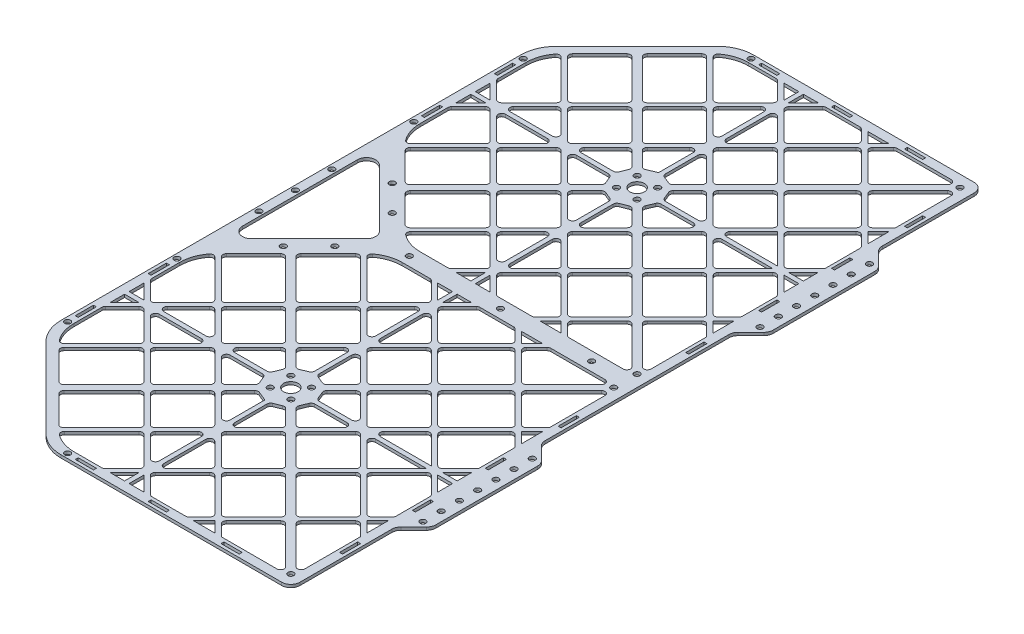
from build123d import *

# Parameters (mm, degrees)
SKETCH1_W               = 190
SKETCH1_H               = 190
BOSS_EXTRUDE1_DEPTH     = 1.6
CUT_EXTRUDE1_DEPTH      = 269.705340475
CUT_EXTRUDE2_DEPTH      = 269.705340475
FILLET1_R               = 20
FILLET5_R               = 5
BOSS_EXTRUDE2_DEPTH     = 1.6
BOSS_EXTRUDE3_DEPTH     = 1.6
BOSS_EXTRUDE5_DEPTH     = 1.6
BOSS_EXTRUDE7_DEPTH     = 1.6
BOSS_EXTRUDE8_DEPTH     = 1.6
BOSS_EXTRUDE9_DEPTH     = 1.6
FILLET3_R               = 2
SKETCH6_R               = 1.6
SKETCH6_R_2             = 4
CUT_EXTRUDE3_DEPTH      = 269.705340475
SKETCH11_W              = 10
SKETCH11_H              = 1.61
SKETCH11_W_2            = 1.61
SKETCH11_H_2            = 10
CUT_EXTRUDE5_DEPTH      = 269.705340475
BOSS_EXTRUDE11_DEPTH    = 1.6
SKETCH19_R              = 1.6
CUT_EXTRUDE8_DEPTH      = 276.86692444
FILLET4_R               = 5
CUT_EXTRUDE7_DEPTH      = 276.86692444
CUT_EXTRUDE7_DEPTH_BACK = 276.86692444
SKETCH17_R              = 1.6
SKETCH12_W              = 5
SKETCH12_H              = 97.157287526
BOSS_EXTRUDE6_DEPTH     = 1.6
FILLET2_R               = 5
SKETCH16_R              = 1.6
CUT_EXTRUDE6_DEPTH      = 430.421191839
SKETCH20_R              = 1.6
CUT_EXTRUDE9_DEPTH      = 430.421191839


with BuildPart() as part:
    # Sketch1 → Boss-Extrude1 (new body)
    with BuildSketch(Plane(origin=(0, 0, 0), x_dir=(1, 0, 0), z_dir=(0, 1, 0))):
        with Locations((95, 95)):
            Rectangle(SKETCH1_W, SKETCH1_H)
    extrude(amount=BOSS_EXTRUDE1_DEPTH)

    # Sketch2 → Cut-Extrude1 (cut, through all)
    with BuildSketch(Plane(origin=(0, 1.6, 0), x_dir=(1, 0, 0), z_dir=(0, 1, 0))):
        Polygon((0, 55.649711575), (55.649711575, 0), (0, 0), align=None)
        Polygon((0, 190), (48.578643763, 190), (0, 141.421356237), align=None)
    extrude(amount=-CUT_EXTRUDE1_DEPTH, mode=Mode.SUBTRACT)

    # Sketch4 → Cut-Extrude2 (cut, through all)
    with BuildSketch(Plane(origin=(0, 1.6, 0), x_dir=(1, 0, 0), z_dir=(0, 1, 0))):
        Polygon((57.720779386, 5), (185, 5), (185, 185), (57.720779386, 185), (5, 132.279220614), (5, 57.720779386), align=None)
    extrude(amount=-CUT_EXTRUDE2_DEPTH, mode=Mode.SUBTRACT)

    # Fillet1
    fillet1_edges = [part.edges().sort_by_distance(p)[0] for p in [
        (0, 0.8, -55.649711575),
        (55.649711575, 0.8, 0),
        (57.720779386, 0.8, -5),
        (5, 0.8, -57.720779386),
        (5, 0.8, -132.279220614),
        (57.720779386, 0.8, -185),
    ]]
    fillet(fillet1_edges, radius=FILLET1_R)

    # Fillet5
    fillet5_edges = [part.edges().sort_by_distance(p)[0] for p in [
        (190, 0.8, 0),
    ]]
    fillet(fillet5_edges, radius=FILLET5_R)



with BuildPart() as body_2:
    # Sketch5 → Boss-Extrude2 (new body)
    with BuildSketch(Plane(origin=(0, 1.6, 0), x_dir=(1, 0, 0), z_dir=(0, 1, 0))):
        Polygon((104.567085809, 85.432914191), (108.529902504, 95), (104.567085809, 104.567085809), (95, 108.529902504), (85.432914191, 104.567085809), (81.470097496, 95), (85.432914191, 85.432914191), (95, 81.470097496), align=None)
    extrude(amount=-BOSS_EXTRUDE2_DEPTH)


with BuildPart() as part_1:
    add(part.part)

    add(body_2.part)  # Boss-Extrude3 merges body 2
    # Sketch7 → Boss-Extrude3 (add)
    with BuildSketch(Plane(origin=(0, 1.6, 0), x_dir=(1, 0, 0), z_dir=(0, 1, 0))):
        Polygon((29.946176131, 157.225396744), (92.171572875, 95), (29.946176131, 32.774603256), (32.774603256, 29.946176131), (95, 92.171572875), (182.171572875, 5), (185, 5), (185, 7.828427125), (97.828427125, 95), (185, 182.171572875), (185, 185), (182.171572875, 185), (95, 97.828427125), (32.774603256, 160.053823869), align=None)
    extrude(amount=-BOSS_EXTRUDE3_DEPTH)

    # Sketch10 → Boss-Extrude5 (add)
    with BuildSketch(Plane(origin=(0, 1.6, 0), x_dir=(1, 0, 0), z_dir=(0, 1, 0))):
        Polygon((96.25, 185), (96.25, 96.25), (185, 96.25), (185, 93.75), (96.25, 93.75), (96.25, 5), (93.75, 5), (93.75, 93.75), (5, 93.75), (5, 96.25), (93.75, 96.25), (93.75, 185), align=None)
    extrude(amount=-BOSS_EXTRUDE5_DEPTH)

    # Sketch13 → Boss-Extrude7 (add)
    with BuildSketch(Plane(origin=(0, 1.6, 0), x_dir=(1, 0, 0), z_dir=(0, 1, 0))):
        Polygon((10.500739648, 52.220039738), (53.28069991, 95), (10.500739648, 137.779960262), (12.268506601, 139.547727215), (55.048466863, 96.767766953), (93.232233047, 134.951533137), (50.452272785, 177.731493399), (52.220039738, 179.499260352), (95, 136.71930009), (143.28069991, 185), (146.816233816, 185), (96.767766953, 134.951533137), (134.951533137, 96.767766953), (185, 146.816233816), (185, 143.28069991), (136.71930009, 95), (185, 46.71930009), (185, 43.183766184), (134.951533137, 93.232233047), (96.767766953, 55.048466863), (146.816233816, 5), (143.28069991, 5), (95, 53.28069991), (52.220039738, 10.500739648), (50.452272785, 12.268506601), (93.232233047, 55.048466863), (55.048466863, 93.232233047), (12.268506601, 50.452272785), align=None)
        Polygon((95, 56.816233816), (56.816233816, 95), (95, 133.183766184), (133.183766184, 95), align=None, mode=Mode.SUBTRACT)
    extrude(amount=-BOSS_EXTRUDE7_DEPTH)

    # Sketch14 → Boss-Extrude8 (add)
    with BuildSketch(Plane(origin=(0, 1.6, 0), x_dir=(1, 0, 0), z_dir=(0, 1, 0))):
        Polygon((5, 82.074639149), (16.157593898, 93.232233047), (93.232233047, 16.157593898), (82.074639149, 5), (85.610173055, 5), (95, 14.389826945), (104.389826945, 5), (107.925360851, 5), (96.767766953, 16.157593898), (173.842406102, 93.232233047), (185, 82.074639149), (185, 85.610173055), (175.610173055, 95), (185, 104.389826945), (185, 107.925360851), (173.842406102, 96.767766953), (96.767766953, 173.842406102), (107.925360851, 185), (104.389826945, 185), (95, 175.610173055), (85.610173055, 185), (82.074639149, 185), (93.232233047, 173.842406102), (16.157593898, 96.767766953), (5, 107.925360851), (5, 104.389826945), (14.389826945, 95), (5, 85.610173055), align=None)
        Polygon((95, 172.074639149), (172.074639149, 95), (95, 17.925360851), (17.925360851, 95), align=None, mode=Mode.SUBTRACT)
    extrude(amount=-BOSS_EXTRUDE8_DEPTH)

    # Sketch15 → Boss-Extrude9 (add)
    with BuildSketch(Plane(origin=(0, 1.6, 0), x_dir=(1, 0, 0), z_dir=(0, 1, 0))):
        Polygon((128.036579926, 185), (185, 128.036579926), (185, 131.572113832), (131.572113832, 185), align=None)
        Polygon((131.572113832, 5), (128.036579926, 5), (185, 61.963420074), (185, 58.427886168), align=None)
    extrude(amount=-BOSS_EXTRUDE9_DEPTH)

    # Fillet3
    fillet3_edges = [part_1.edges().sort_by_distance(p)[0] for p in [
        (29.946176131, 0.8, -32.774603256),
        (32.774603256, 0.8, -29.946176131),
        (182.171572875, 0.8, -5),
        (185, 0.8, -7.828427125),
        (185, 0.8, -182.171572875),
        (182.171572875, 0.8, -185),
        (32.774603256, 0.8, -160.053823869),
        (29.946176131, 0.8, -157.225396744),
        (87.432914191, 0.8, -105.395512934),
        (102.567085809, 0.8, -105.395512934),
        (105.395512934, 0.8, -102.567085809),
        (105.395512934, 0.8, -87.432914191),
        (102.567085809, 0.8, -84.604487066),
        (87.432914191, 0.8, -84.604487066),
        (84.604487066, 0.8, -87.432914191),
        (84.604487066, 0.8, -102.567085809),
        (81.987864449, 0.8, -93.75),
        (81.987864449, 0.8, -96.25),
        (96.25, 0.8, -81.987864449),
        (108.012135551, 0.8, -93.75),
        (108.012135551, 0.8, -96.25),
        (96.25, 0.8, -108.012135551),
        (93.75, 0.8, -108.012135551),
        (96.25, 0.8, -131.933766184),
        (96.25, 0.8, -137.96930009),
        (93.75, 0.8, -131.933766184),
        (93.75, 0.8, -137.96930009),
        (137.96930009, 0.8, -96.25),
        (131.933766184, 0.8, -93.75),
        (137.96930009, 0.8, -93.75),
        (96.25, 0.8, -52.03069991),
        (93.75, 0.8, -58.066233816),
        (93.75, 0.8, -52.03069991),
        (52.03069991, 0.8, -96.25),
        (52.03069991, 0.8, -93.75),
        (75.554563517, 0.8, -117.273863607),
        (114.445436483, 0.8, -117.273863607),
        (117.273863607, 0.8, -75.554563517),
        (75.554563517, 0.8, -72.726136393),
        (72.726136393, 0.8, -75.554563517),
        (114.445436483, 0.8, -72.726136393),
        (117.273863607, 0.8, -114.445436483),
        (72.726136393, 0.8, -114.445436483),
        (55.048466863, 0.8, -96.767766953),
        (74.493903346, 0.8, -77.32233047),
        (77.32233047, 0.8, -74.493903346),
        (58.066233816, 0.8, -93.75),
        (112.67766953, 0.8, -74.493903346),
        (115.506096654, 0.8, -77.32233047),
        (96.25, 0.8, -58.066233816),
        (74.493903346, 0.8, -112.67766953),
        (77.32233047, 0.8, -115.506096654),
        (58.066233816, 0.8, -96.25),
        (115.506096654, 0.8, -112.67766953),
        (112.67766953, 0.8, -115.506096654),
        (131.933766184, 0.8, -96.25),
        (12.268506601, 0.8, -50.452272785),
        (10.505249519, 0.8, -52.224549609),
        (10.505249519, 0.8, -137.775450391),
        (12.268506601, 0.8, -139.547727215),
        (93.232233047, 0.8, -134.951533137),
        (50.452272785, 0.8, -177.731493399),
        (52.224549609, 0.8, -179.494750481),
        (146.816233816, 0.8, -185),
        (96.767766953, 0.8, -134.951533137),
        (134.951533137, 0.8, -96.767766953),
        (185, 0.8, -146.816233816),
        (134.951533137, 0.8, -93.232233047),
        (96.767766953, 0.8, -55.048466863),
        (146.816233816, 0.8, -5),
        (52.224549609, 0.8, -10.505249519),
        (50.452272785, 0.8, -12.268506601),
        (93.232233047, 0.8, -55.048466863),
        (55.048466863, 0.8, -93.232233047),
        (37.370797333, 0.8, -75.554563517),
        (35.60303038, 0.8, -73.786796564),
        (37.370797333, 0.8, -114.445436483),
        (35.60303038, 0.8, -116.213203436),
        (114.445436483, 0.8, -37.370797333),
        (116.213203436, 0.8, -35.60303038),
        (152.629202667, 0.8, -114.445436483),
        (154.39696962, 0.8, -116.213203436),
        (136.71930009, 0.8, -133.890872965),
        (114.445436483, 0.8, -156.164736573),
        (96.767766953, 0.8, -173.842406102),
        (156.164736573, 0.8, -114.445436483),
        (134.951533137, 0.8, -132.123106012),
        (132.123106012, 0.8, -134.951533137),
        (96.25, 0.8, -170.824639149),
        (112.67766953, 0.8, -154.39696962),
        (114.445436483, 0.8, -152.629202667),
        (154.39696962, 0.8, -112.67766953),
        (133.890872965, 0.8, -53.28069991),
        (156.164736573, 0.8, -75.554563517),
        (173.842406102, 0.8, -93.232233047),
        (114.445436483, 0.8, -33.835263427),
        (132.123106012, 0.8, -55.048466863),
        (134.951533137, 0.8, -57.876893988),
        (96.25, 0.8, -19.175360851),
        (152.629202667, 0.8, -75.554563517),
        (112.67766953, 0.8, -35.60303038),
        (53.28069991, 0.8, -133.890872965),
        (75.554563517, 0.8, -156.164736573),
        (33.835263427, 0.8, -114.445436483),
        (16.157593898, 0.8, -96.767766953),
        (55.048466863, 0.8, -132.123106012),
        (57.876893988, 0.8, -134.951533137),
        (19.175360851, 0.8, -96.25),
        (93.75, 0.8, -170.824639149),
        (77.32233047, 0.8, -154.39696962),
        (75.554563517, 0.8, -152.629202667),
        (35.60303038, 0.8, -112.67766953),
        (53.28069991, 0.8, -56.109127035),
        (75.554563517, 0.8, -33.835263427),
        (93.232233047, 0.8, -16.157593898),
        (33.835263427, 0.8, -75.554563517),
        (55.048466863, 0.8, -57.876893988),
        (57.876893988, 0.8, -55.048466863),
        (19.175360851, 0.8, -93.75),
        (93.75, 0.8, -19.175360851),
        (77.32233047, 0.8, -35.60303038),
        (75.554563517, 0.8, -37.370797333),
        (35.60303038, 0.8, -77.32233047),
        (5, 0.8, -82.074639149),
        (5, 0.8, -107.925360851),
        (56.109127035, 0.8, -136.71930009),
        (73.786796564, 0.8, -154.39696962),
        (93.232233047, 0.8, -173.842406102),
        (82.074639149, 0.8, -185),
        (107.925360851, 0.8, -185),
        (133.890872965, 0.8, -136.71930009),
        (116.213203436, 0.8, -154.39696962),
        (173.842406102, 0.8, -96.767766953),
        (185, 0.8, -107.925360851),
        (185, 0.8, -82.074639149),
        (136.71930009, 0.8, -56.109127035),
        (154.39696962, 0.8, -73.786796564),
        (96.767766953, 0.8, -16.157593898),
        (107.925360851, 0.8, -5),
        (82.074639149, 0.8, -5),
        (56.109127035, 0.8, -53.28069991),
        (73.786796564, 0.8, -35.60303038),
        (16.157593898, 0.8, -93.232233047),
        (177.377940008, 0.8, -139.194173824),
        (175.610173055, 0.8, -137.426406871),
        (157.932503526, 0.8, -155.104076401),
        (135.658639918, 0.8, -177.377940008),
        (177.377940008, 0.8, -135.658639918),
        (185, 0.8, -128.036579926),
        (159.700270479, 0.8, -156.871843354),
        (155.104076401, 0.8, -157.932503526),
        (137.426406871, 0.8, -175.610173055),
        (156.871843354, 0.8, -159.700270479),
        (139.194173824, 0.8, -177.377940008),
        (128.036579926, 0.8, -185),
        (139.194173824, 0.8, -12.622059992),
        (137.426406871, 0.8, -14.389826945),
        (155.104076401, 0.8, -32.067496474),
        (177.377940008, 0.8, -54.341360082),
        (135.658639918, 0.8, -12.622059992),
        (128.036579926, 0.8, -5),
        (156.871843354, 0.8, -30.299729521),
        (185, 0.8, -61.963420074),
        (157.932503526, 0.8, -34.895923599),
        (175.610173055, 0.8, -52.573593129),
        (159.700270479, 0.8, -33.128156646),
        (177.377940008, 0.8, -50.805826176),
    ]]
    fillet(fillet3_edges, radius=FILLET3_R)

    # Sketch6 → Cut-Extrude3 (cut, through all)
    with BuildSketch(Plane(origin=(0, 1.6, 0), x_dir=(1, 0, 0), z_dir=(0, 1, 0))):
        with Locations(Location((89.343145751, 89.343145751, 0), (0, 0, 270))):
            Circle(SKETCH6_R)
        with Locations(Location((100.656854249, 89.343145751, 0), (0, 0, 270))):
            Circle(SKETCH6_R)
        with Locations(Location((100.656854249, 100.656854249, 0), (0, 0, 270))):
            Circle(SKETCH6_R)
        with Locations(Location((89.343145751, 100.656854249, 0), (0, 0, 270))):
            Circle(SKETCH6_R)
        with Locations(Location((95, 95, 0), (0, 0, 270))):
            Circle(SKETCH6_R_2)
    extrude(amount=-CUT_EXTRUDE3_DEPTH, mode=Mode.SUBTRACT)

    # Sketch11 → Cut-Extrude5 (cut, through all)
    with BuildSketch(Plane(origin=(0, 1.6, 0), x_dir=(1, 0, 0), z_dir=(0, 1, 0))):
        with Locations((115, 2.5)):
            Rectangle(SKETCH11_W, SKETCH11_H)
        with Locations((155, 2.5)):
            Rectangle(SKETCH11_W, SKETCH11_H)
        with Locations((75, 2.5)):
            Rectangle(SKETCH11_W, SKETCH11_H)
        with Locations((187.5, 115)):
            Rectangle(SKETCH11_W_2, SKETCH11_H_2)
        with Locations((187.5, 155)):
            Rectangle(SKETCH11_W_2, SKETCH11_H_2)
        with Locations((187.5, 75)):
            Rectangle(SKETCH11_W_2, SKETCH11_H_2)
        with Locations((187.5, 35)):
            Rectangle(SKETCH11_W_2, SKETCH11_H_2)
        with Locations((2.5, 75)):
            Rectangle(SKETCH11_W_2, SKETCH11_H_2)
        with Locations((2.5, 115)):
            Rectangle(SKETCH11_W_2, SKETCH11_H_2)
    extrude(amount=-CUT_EXTRUDE5_DEPTH, mode=Mode.SUBTRACT)

    # Sketch18 → Boss-Extrude11 (add)
    with BuildSketch(Plane(origin=(0, 1.6, 0), x_dir=(1, 0, 0), z_dir=(0, 1, 0))):
        Polygon((190, 137.5), (190, 57.5), (200, 67.5), (200, 127.5), align=None)
    extrude(amount=-BOSS_EXTRUDE11_DEPTH)

    # Sketch19 → Cut-Extrude8 (cut, through all)
    with BuildSketch(Plane(origin=(0, 1.6, 0), x_dir=(1, 0, 0), z_dir=(0, 1, 0))):
        with Locations(Location((195, 97.5, 0), (0, 0, 270))):
            Circle(SKETCH19_R)
        with Locations(Location((195, 107.5, 0), (0, 0, 270))):
            Circle(SKETCH19_R)
        with Locations(Location((195, 117.5, 0), (0, 0, 270))):
            Circle(SKETCH19_R)
        with Locations(Location((195, 127.5, 0), (0, 0, 270))):
            Circle(SKETCH19_R)
        with Locations(Location((195, 87.5, 0), (0, 0, 270))):
            Circle(SKETCH19_R)
        with Locations(Location((195, 77.5, 0), (0, 0, 270))):
            Circle(SKETCH19_R)
        with Locations(Location((195, 67.5, 0), (0, 0, 270))):
            Circle(SKETCH19_R)
    extrude(amount=-CUT_EXTRUDE8_DEPTH, mode=Mode.SUBTRACT)

    # Fillet4
    fillet4_edges = [part_1.edges().sort_by_distance(p)[0] for p in [
        (190, 0.8, -57.5),
        (200, 0.8, -67.5),
        (200, 0.8, -127.5),
        (190, 0.8, -137.5),
    ]]
    fillet(fillet4_edges, radius=FILLET4_R)

    # Sketch17 → Cut-Extrude7 (cut, two sides: drawn at the far end of the back side and taken through both)
    with BuildSketch(Plane(origin=(0, 1.6, 0), x_dir=(1, 0, 0), z_dir=(0, 1, 0)).offset(-CUT_EXTRUDE7_DEPTH_BACK)):
        with Locations(Location((183.585786438, 6.414213562, 0), (0, 0, 270))):
            Circle(SKETCH17_R)
        with Locations(Location((65, 2.5, 0), (0, 0, 270))):
            Circle(SKETCH17_R)
        with Locations(Location((2.5, 65, 0), (0, 0, 90))):
            Circle(SKETCH17_R)
        with Locations(Location((2.5, 125, 0), (0, 0, 270))):
            Circle(SKETCH17_R)
        with Locations(Location((183.585786438, 183.585786438, 0), (0, 0, 90))):
            Circle(SKETCH17_R)
    extrude(amount=CUT_EXTRUDE7_DEPTH + CUT_EXTRUDE7_DEPTH_BACK, mode=Mode.SUBTRACT)

    # Mirror2: part across plane


with BuildPart() as part_2:
    add(part_1.part)
    add(part_1.part.mirror(Plane(origin=(0, 1.6, -190), x_dir=(1, 0, 0), z_dir=(0, 0, 1))))

    # Sketch12 → Boss-Extrude6 (add)
    with BuildSketch(Plane(origin=(0, 1.6, 0), x_dir=(1, 0, 0), z_dir=(0, 1, 0))):
        with Locations((2.5, 190)):
            Rectangle(SKETCH12_W, SKETCH12_H)
    extrude(amount=-BOSS_EXTRUDE6_DEPTH)

    # Fillet2
    fillet2_edges = [part_2.edges().sort_by_distance(p)[0] for p in [
        (48.578643763, 0.8, -190),
        (5, 0.8, -233.578643763),
        (5, 0.8, -146.421356237),
    ]]
    fillet(fillet2_edges, radius=FILLET2_R)

    # Sketch16 → Cut-Extrude6 (cut, through all)
    with BuildSketch(Plane(origin=(0, 1.6, 0), x_dir=(1, 0, 0), z_dir=(0, 1, 0))):
        with Locations(Location((165, 190, 0), (0, 0, 270))):
            Circle(SKETCH16_R)
        with Locations(Location((115, 190, 0), (0, 0, 270))):
            Circle(SKETCH16_R)
        with Locations(Location((65, 190, 0), (0, 0, 270))):
            Circle(SKETCH16_R)
    extrude(amount=-CUT_EXTRUDE6_DEPTH, mode=Mode.SUBTRACT)

    # Sketch20 → Cut-Extrude9 (cut, through all)
    with BuildSketch(Plane(origin=(0, 1.6, 0), x_dir=(1, 0, 0), z_dir=(0, 1, 0))):
        with Locations(Location((39.895923599, 205.753787975, 0), (0, 0, 270))):
            Circle(SKETCH20_R)
        with Locations(Location((25.753787975, 219.895923599, 0), (0, 0, 90))):
            Circle(SKETCH20_R)
        with Locations(Location((25.753787975, 160.104076401, 0), (0, 0, 270))):
            Circle(SKETCH20_R)
        with Locations(Location((39.895923599, 174.246212025, 0), (0, 0, 90))):
            Circle(SKETCH20_R)
        with Locations(Location((2.5, 170, 0), (0, 0, 270))):
            Circle(SKETCH20_R)
        with Locations(Location((2.5, 190, 0), (0, 0, 270))):
            Circle(SKETCH20_R)
        with Locations(Location((2.5, 210, 0), (0, 0, 90))):
            Circle(SKETCH20_R)
    extrude(amount=-CUT_EXTRUDE9_DEPTH, mode=Mode.SUBTRACT)


solid = part_2.part
